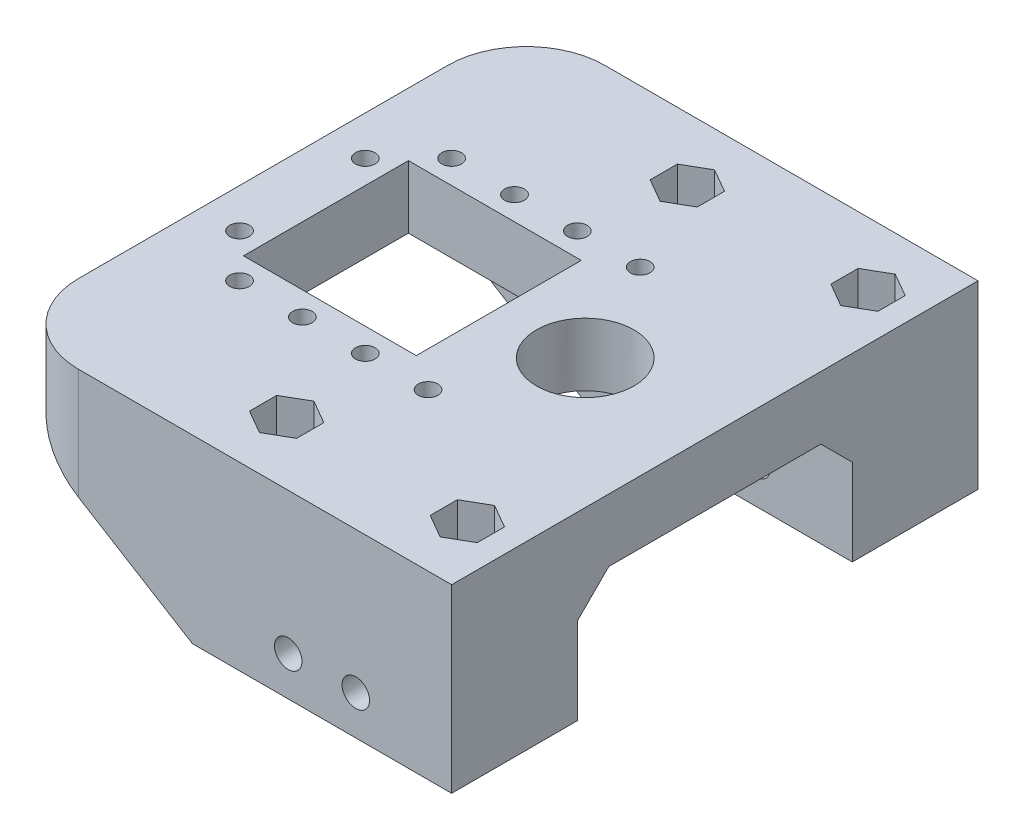
from build123d import *
from OCP.BRepFilletAPI import BRepFilletAPI_MakeChamfer

# Parameters (mm, degrees)
DODANIE_WYCI_GNI_CIE1_DEPTH      = 23.5
DODANIE_WYCI_GNI_CIE1_DEPTH_BACK = 23.5
SZKIC1_W                         = 33
SZKIC1_H                         = 15
SZKIC2_W                         = 35
SZKIC2_H                         = 15
WYTNIJ_WYCI_GNI_CIE1_DEPTH       = 42.200728149
SZKIC3_R                         = 1.75
WYTNIJ_WYCI_GNI_CIE2_DEPTH       = 51.373604199
SZKIC4_W                         = 33
SZKIC4_H                         = 47
DODANIE_WYCI_GNI_CIE2_DEPTH      = 8
SZKIC5_R                         = 6.2
SZKIC5_W                         = 11
SZKIC5_H                         = 21
WYTNIJ_WYCI_GNI_CIE3_DEPTH       = 9
DODANIE_WYCI_GNI_CIE3_DEPTH      = 8
SZKIC8_R                         = 1.25
WYTNIJ_WYCI_GNI_CIE4_DEPTH       = 9
SZKIC10_R                        = 2.2
WYTNIJ_WYCI_GNI_CIE5_DEPTH       = 2
SZKIC11_R                        = 1.75
DODANIE_WYCI_GNI_CIE4_DEPTH      = 10
SZKIC12_R                        = 1.85
WYTNIJ_WYCI_GNI_CIE6_DEPTH       = 58.725644215
WYTNIJ_WYCI_GNI_CIE7_DEPTH       = 6
SFAZOWANIE1_SIZE                 = 24.5
SFAZOWANIE1_SIZE_2               = 15
ZAOKR_GLENIE1_R                  = 10
SFAZOWANIE2_SIZE                 = 4
SZKIC14_R                        = 4.5
WYTNIJ_WYCI_GNI_CIE8_DEPTH       = 1.5


# Some blends are built 0.0001 mm under size
with BuildPart() as part:
    # Szkic1 → Dodanie-wyciągnięcie1 (new, two sides: drawn at the far end of the back side and taken through both)
    with BuildSketch(Plane.XY.offset(-DODANIE_WYCI_GNI_CIE1_DEPTH_BACK)):
        Rectangle(SZKIC1_W, SZKIC1_H)
    extrude(amount=DODANIE_WYCI_GNI_CIE1_DEPTH + DODANIE_WYCI_GNI_CIE1_DEPTH_BACK)

    # Szkic2 → Wytnij-wyciągnięcie1 (cut, through all)
    with BuildSketch(Plane(origin=(16.5, 0, 0), x_dir=(0, 0, -1), z_dir=(1, 0, 0))):
        Rectangle(SZKIC2_W, SZKIC2_H)
    extrude(amount=-WYTNIJ_WYCI_GNI_CIE1_DEPTH, mode=Mode.SUBTRACT)


with BuildPart() as wytnij_wyci_gni_cie1_piece_1:
    # of the separate pieces the step leaves, piece 1, a body of its own (wytnij_wyci_gni_cie1_pieces)
    add(part.part.solids().sort_by_distance((-16.5, -7.5, -17.5))[0])


with BuildPart() as wytnij_wyci_gni_cie1_piece_2:
    # of the separate pieces the step leaves, piece 2, a body of its own (wytnij_wyci_gni_cie1_pieces)
    add(part.part.solids().sort_by_distance((-16.5, -7.5, 23.5))[0])


with BuildPart() as wytnij_wyci_gni_cie2_tool:
    # Szkic3 → Wytnij-wyciągnięcie2 (new, through all)
    with BuildSketch(Plane.XY.offset(23.5)):
        with Locations((-4.3, -2.5)):
            Circle(SZKIC3_R)
        with Locations((4.3, -2.5)):
            Circle(SZKIC3_R)
    extrude(amount=-WYTNIJ_WYCI_GNI_CIE2_DEPTH)


with BuildPart() as wytnij_wyci_gni_cie1_piece_1_1:
    add(wytnij_wyci_gni_cie1_piece_1.part)

    # Wytnij-wyciągnięcie2: cut by wytnij_wyci_gni_cie2_tool
    add(wytnij_wyci_gni_cie2_tool.part, mode=Mode.SUBTRACT)



with BuildPart() as wytnij_wyci_gni_cie1_piece_2_1:
    add(wytnij_wyci_gni_cie1_piece_2.part)

    # Wytnij-wyciągnięcie2: cut by wytnij_wyci_gni_cie2_tool
    add(wytnij_wyci_gni_cie2_tool.part, mode=Mode.SUBTRACT)


with BuildPart() as wytnij_wyci_gni_cie1_piece_1_2:
    add(wytnij_wyci_gni_cie1_piece_1_1.part)

    add(wytnij_wyci_gni_cie1_piece_2_1.part)  # Dodanie-wyciągnięcie2 merges Wytnij-wyciągnięcie1 piece 2
    # Szkic4 → Dodanie-wyciągnięcie2 (add)
    with BuildSketch(Plane(origin=(0, 7.5, 0), x_dir=(1, 0, 0), z_dir=(0, 1, 0))):
        Rectangle(SZKIC4_W, SZKIC4_H)
    extrude(amount=DODANIE_WYCI_GNI_CIE2_DEPTH)

    # Szkic5 → Wytnij-wyciągnięcie3 (cut)
    with BuildSketch(Plane(origin=(0, 15.5, 0), x_dir=(1, 0, 0), z_dir=(0, 1, 0))):
        with Locations(Location((0, 0, 0), (0, 0, 270))):
            Circle(SZKIC5_R)
        with Locations((-16.5, 0)):
            Rectangle(SZKIC5_W, SZKIC5_H)
    extrude(amount=-WYTNIJ_WYCI_GNI_CIE3_DEPTH, mode=Mode.SUBTRACT)

    # Szkic7 → Dodanie-wyciągnięcie3 (add)
    with BuildSketch(Plane(origin=(0, 15.5, 0), x_dir=(1, 0, 0), z_dir=(0, 1, 0))):
        Polygon((-16.5, 10.5), (-16.5, 23.5), (-33, 23.5), (-41, 23.5), (-41, -23.5), (-33, -23.5), (-16.5, -23.5), (-16.5, -10.5), (-33, -10.5), (-33, 10.5), align=None)
    extrude(amount=-DODANIE_WYCI_GNI_CIE3_DEPTH)

    # Szkic8 → Wytnij-wyciągnięcie4 (cut)
    with BuildSketch(Plane(origin=(0, 15.5, 0), x_dir=(1, 0, 0), z_dir=(0, 1, 0))):
        with Locations(Location((-30.5, -13.5, 0), (0, 0, 270))):
            Circle(SZKIC8_R)
        with Locations(Location((-36, -8, 0), (0, 0, 270))):
            Circle(SZKIC8_R)
        with Locations(Location((-22.5, -13.5, 0), (0, 0, 270))):
            Circle(SZKIC8_R)
        with Locations(Location((-14.5, -13.5, 0), (0, 0, 270))):
            Circle(SZKIC8_R)
        with Locations(Location((-6.5, -13.5, 0), (0, 0, 270))):
            Circle(SZKIC8_R)
    wytnij_wyci_gni_cie4 = extrude(amount=-WYTNIJ_WYCI_GNI_CIE4_DEPTH, mode=Mode.SUBTRACT)

    # Szkic10 → Wytnij-wyciągnięcie5 (cut)
    with BuildSketch(Plane.XZ.offset(-7.5)):
        with Locations(Location((-36, 8, 0), (0, 0, 270))):
            Circle(SZKIC10_R)
        with Locations(Location((-30.5, 13.5, 0), (0, 0, 270))):
            Circle(SZKIC10_R)
        with Locations(Location((-22.5, 13.5, 0), (0, 0, 270))):
            Circle(SZKIC10_R)
        with Locations(Location((-14.5, 13.5, 0), (0, 0, 270))):
            Circle(SZKIC10_R)
        with Locations(Location((-6.5, 13.5, 0), (0, 0, 270))):
            Circle(SZKIC10_R)
    wytnij_wyci_gni_cie5 = extrude(amount=-WYTNIJ_WYCI_GNI_CIE5_DEPTH, mode=Mode.SUBTRACT)

    # Lustro2: Wytnij-wyciągnięcie4, Wytnij-wyciągnięcie5 across plane
    add(wytnij_wyci_gni_cie4.mirror(Plane.XY), mode=Mode.SUBTRACT)
    add(wytnij_wyci_gni_cie5.mirror(Plane.XY), mode=Mode.SUBTRACT)

    # Szkic11 → Dodanie-wyciągnięcie4 (add)
    with BuildSketch(Plane.XY.offset(23.5)):
        Polygon((-16.5, 7.5), (-16.5, -7.5), (16.5, -7.5), (16.5, 15.5), (-41, 15.5), (-41, 7.5), align=None)
        with Locations((-4.3, -2.5)):
            Circle(SZKIC11_R, mode=Mode.SUBTRACT)
        with Locations((4.3, -2.5)):
            Circle(SZKIC11_R, mode=Mode.SUBTRACT)
    dodanie_wyci_gni_cie4 = extrude(amount=DODANIE_WYCI_GNI_CIE4_DEPTH)

    # Szkic12 → Wytnij-wyciągnięcie6 (cut, through all)
    with BuildSketch(Plane.XZ.offset(7.5)):
        with Locations(Location((-12.5, 25.5, 0), (0, 0, 270))):
            Circle(SZKIC12_R)
        with Locations(Location((10.5, 25.5, 0), (0, 0, 270))):
            Circle(SZKIC12_R)
    wytnij_wyci_gni_cie6 = extrude(amount=-WYTNIJ_WYCI_GNI_CIE6_DEPTH, mode=Mode.SUBTRACT)

    # Szkic13 → Wytnij-wyciągnięcie7 (cut)
    with BuildSketch(Plane(origin=(0, 15.5, 0), x_dir=(1, 0, 0), z_dir=(0, 1, 0))):
        Polygon((-12.5, -22.035898385), (-15.5, -23.767949192), (-15.5, -27.232050808), (-12.5, -28.964101615), (-9.5, -27.232050808), (-9.5, -23.767949192), align=None)
        Polygon((10.5, -22.035898385), (7.5, -23.767949192), (7.5, -27.232050808), (10.5, -28.964101615), (13.5, -27.232050808), (13.5, -23.767949192), align=None)
    wytnij_wyci_gni_cie7 = extrude(amount=-WYTNIJ_WYCI_GNI_CIE7_DEPTH, mode=Mode.SUBTRACT)

    # Lustro6: Dodanie-wyciągnięcie4, Wytnij-wyciągnięcie6, Wytnij-wyciągnięcie7 across plane
    add(dodanie_wyci_gni_cie4.mirror(Plane.XY))
    add(wytnij_wyci_gni_cie6.mirror(Plane.XY), mode=Mode.SUBTRACT)
    add(wytnij_wyci_gni_cie7.mirror(Plane.XY), mode=Mode.SUBTRACT)

    # Sfazowanie1
    sfazowanie1_edges_1 = [wytnij_wyci_gni_cie1_piece_1_2.edges().sort_by_distance(p)[0] for p in [
        (-16.5, 7.5, -28.5),
    ]]
    sfazowanie1_side_1 = [wytnij_wyci_gni_cie1_piece_1_2.faces().sort_by_distance(p)[0] for p in [
        (-16.8, 7.5, -28.5),
    ]]
    sfazowanie1_edges_2 = [wytnij_wyci_gni_cie1_piece_1_2.edges().sort_by_distance(p)[0] for p in [
        (-16.5, 7.5, 25.5),
    ]]
    sfazowanie1_side_2 = [wytnij_wyci_gni_cie1_piece_1_2.faces().sort_by_distance(p)[0] for p in [
        (-16.5, 7.2, 25.5),
    ]]
    sfazowanie1 = BRepFilletAPI_MakeChamfer(wytnij_wyci_gni_cie1_piece_1_2.part.solid().wrapped)
    for e in sfazowanie1_edges_1:
        sfazowanie1.Add(SFAZOWANIE1_SIZE - 0.0001, SFAZOWANIE1_SIZE_2 - 0.0001, e.wrapped, sfazowanie1_side_1[0].wrapped)
    for e in sfazowanie1_edges_2:
        sfazowanie1.Add(SFAZOWANIE1_SIZE_2 - 0.0001, SFAZOWANIE1_SIZE - 0.0001, e.wrapped, sfazowanie1_side_2[0].wrapped)
    add(Compound.cast(sfazowanie1.Shape()), mode=Mode.REPLACE)  # a hair under: the kernel refuses the full size

    # Zaokrąglenie1
    zaokr_glenie1_edges = [wytnij_wyci_gni_cie1_piece_1_2.edges().sort_by_distance(p)[0] for p in [
        (-41, 11.5, 33.5),
        (-41, 11.5, -33.5),
    ]]
    fillet(zaokr_glenie1_edges, radius=ZAOKR_GLENIE1_R)

    # Sfazowanie2
    # the kernel refuses this chamfer: 4 mm, written as the material it adds along each edge
    with BuildSketch(Plane(origin=(-51.286631952, 7.5, -17.5), x_dir=(0, 0.02749587661058627, 0.9996219169112968), z_dir=(1, 0, 0))) as sfazowanie2_piece_1_section:
        Polygon((SFAZOWANIE2_SIZE * 0.999621916911, SFAZOWANIE2_SIZE * 0.0274958766106), (-SFAZOWANIE2_SIZE * 0.0274958766106, SFAZOWANIE2_SIZE * 0.999621916911), (0, 0), align=None)
    sfazowanie2_piece_1 = extrude(amount=67.786631952, mode=Mode.PRIVATE)
    sfazowanie2_piece_1 = split(sfazowanie2_piece_1, bisect_by=Plane(origin=(-41, 6.15842539, -16.26773288), z_dir=(1, 0, 0)), keep=Keep.TOP, mode=Mode.PRIVATE)
    sfazowanie2_piece_1 = split(sfazowanie2_piece_1, bisect_by=Plane(origin=(-18.343955111, -6.370950809, -16.26773288), z_dir=(0.5221528778597931, 0.852851905164511, 0)), keep=Keep.TOP, mode=Mode.PRIVATE)
    sfazowanie2_piece_1 = sfazowanie2_piece_1 - Plane(origin=(-30.5, 6.15842539, -13.5), x_dir=(0, 0, 1), z_dir=(0, -1, 0)) * Cylinder(2.2, 152, mode=Mode.PRIVATE)
    sfazowanie2_piece_1 = sfazowanie2_piece_1 - Plane(origin=(-22.5, 6.15842539, -13.5), x_dir=(0, 0, 1), z_dir=(0, -1, 0)) * Cylinder(2.2, 152, mode=Mode.PRIVATE)
    sfazowanie2_piece_1 = sfazowanie2_piece_1 - Plane(origin=(-14.5, 6.15842539, -13.5), x_dir=(0, 0, 1), z_dir=(0, -1, 0)) * Cylinder(2.2, 152, mode=Mode.PRIVATE)
    sfazowanie2_piece_1 = sfazowanie2_piece_1 - Plane(origin=(-6.5, 6.15842539, -13.5), x_dir=(0, 0, 1), z_dir=(0, -1, 0)) * Cylinder(2.2, 152, mode=Mode.PRIVATE)
    add(sfazowanie2_piece_1)
    with BuildSketch(Plane(origin=(-51.286631952, 7.5, 17.5), x_dir=(0, 0.02749587661058627, -0.9996219169112968), z_dir=(1, 0, 0))) as sfazowanie2_piece_2_section:
        Polygon((SFAZOWANIE2_SIZE * 0.999621916911, -SFAZOWANIE2_SIZE * 0.0274958766106), (-SFAZOWANIE2_SIZE * 0.0274958766106, -SFAZOWANIE2_SIZE * 0.999621916911), (0, 0), align=None)
    sfazowanie2_piece_2 = extrude(amount=67.786631952, mode=Mode.PRIVATE)
    sfazowanie2_piece_2 = split(sfazowanie2_piece_2, bisect_by=Plane(origin=(-18.343955111, -6.370950809, 16.26773288), z_dir=(0.5221528778597931, 0.8528519051645109, 0)), keep=Keep.TOP, mode=Mode.PRIVATE)
    sfazowanie2_piece_2 = split(sfazowanie2_piece_2, bisect_by=Plane(origin=(-41, 6.15842539, 16.26773288), z_dir=(1, 0, 0)), keep=Keep.TOP, mode=Mode.PRIVATE)
    sfazowanie2_piece_2 = sfazowanie2_piece_2 - Plane(origin=(-30.5, 6.15842539, 13.5), x_dir=(0, 0, -1), z_dir=(0, -1, 0)) * Cylinder(2.2, 152, mode=Mode.PRIVATE)
    sfazowanie2_piece_2 = sfazowanie2_piece_2 - Plane(origin=(-22.5, 6.15842539, 13.5), x_dir=(0, 0, -1), z_dir=(0, -1, 0)) * Cylinder(2.2, 152, mode=Mode.PRIVATE)
    sfazowanie2_piece_2 = sfazowanie2_piece_2 - Plane(origin=(-14.5, 6.15842539, 13.5), x_dir=(0, 0, -1), z_dir=(0, -1, 0)) * Cylinder(2.2, 152, mode=Mode.PRIVATE)
    sfazowanie2_piece_2 = sfazowanie2_piece_2 - Plane(origin=(-6.5, 6.15842539, 13.5), x_dir=(0, 0, -1), z_dir=(0, -1, 0)) * Cylinder(2.2, 152, mode=Mode.PRIVATE)
    add(sfazowanie2_piece_2)

    # Szkic14 → Wytnij-wyciągnięcie8 (cut)
    with BuildSketch(Plane.XZ.offset(7.5)):
        with Locations(Location((-12.5, 25.5, 0), (0, 0, 270))):
            Circle(SZKIC14_R)
        with Locations(Location((10.5, 25.5, 0), (0, 0, 270))):
            Circle(SZKIC14_R)
        with Locations(Location((10.5, -25.5, 0), (0, 0, 270))):
            Circle(SZKIC14_R)
        with Locations(Location((-12.5, -25.5, 0), (0, 0, 270))):
            Circle(SZKIC14_R)
    extrude(amount=-WYTNIJ_WYCI_GNI_CIE8_DEPTH, mode=Mode.SUBTRACT)


solid = wytnij_wyci_gni_cie1_piece_1_2.part
